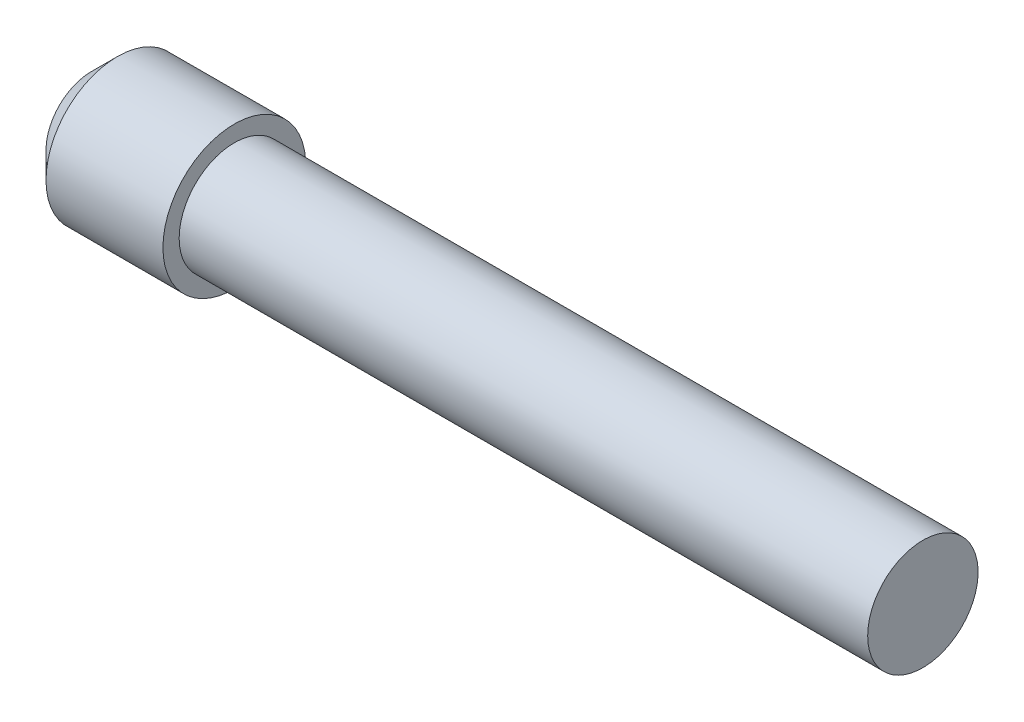
from build123d import *

# Parameters (mm, degrees)
CHAMFER1_SIZE = 1


with BuildPart() as part:
    # Sketch1 → Revolve1 (revolve)
    with BuildSketch(Plane.XY):
        Polygon((0, 2.75), (-5.5, 2.75), (-5.5, 0), (26.5, 0), (26.5, 2.125), (0, 2.125), align=None)
    revolve(axis=Axis((-9.458937198, 0, 0), (1, 0, 0)))

    # Chamfer1
    chamfer1_edges = [part.edges().sort_by_distance(p)[0] for p in [
        (-5.5, -2.75, 0),
    ]]
    chamfer(chamfer1_edges, length=CHAMFER1_SIZE)


solid = part.part
